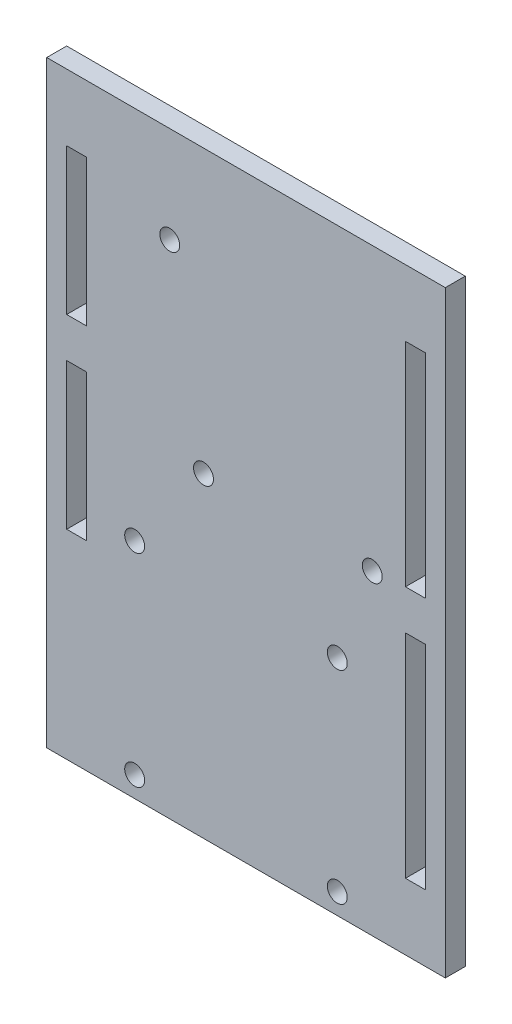
from build123d import *

# Parameters (mm, degrees)
SKETCH1_W           = 60
SKETCH1_H           = 90
BOSS_EXTRUDE1_DEPTH = 3
SKETCH3_R           = 1.5
CUT_EXTRUDE2_DEPTH  = 3
SKETCH4_R           = 1.5
CUT_EXTRUDE3_DEPTH  = 55.166410256
SKETCH5_W           = 3
SKETCH5_H           = 32
CUT_EXTRUDE4_DEPTH  = 55.166410256
SKETCH6_W           = 3
SKETCH6_H           = 22
CUT_EXTRUDE5_DEPTH  = 55.166410256


with BuildPart() as part:
    # Sketch1 → Boss-Extrude1 (new body)
    with BuildSketch(Plane.XY):
        Rectangle(SKETCH1_W, SKETCH1_H)
    extrude(amount=-BOSS_EXTRUDE1_DEPTH)

    # Sketch3 → Cut-Extrude2 (cut)
    with BuildSketch(Plane.XY):
        with Locations((-11.48, 30.5)):
            Circle(SKETCH3_R)
        with Locations((-6.4, 2.56)):
            Circle(SKETCH3_R)
        with Locations((19, 2.56)):
            Circle(SKETCH3_R)
    extrude(amount=-CUT_EXTRUDE2_DEPTH, mode=Mode.SUBTRACT)

    # Sketch4 → Cut-Extrude3 (cut, through all)
    with BuildSketch(Plane.XY):
        with Locations((-16.762789551, -41.88018292)):
            Circle(SKETCH4_R)
        with Locations((-16.762789551, -11.38018292)):
            Circle(SKETCH4_R)
        with Locations((13.737210449, -41.88018292)):
            Circle(SKETCH4_R)
        with Locations((13.737210449, -11.38018292)):
            Circle(SKETCH4_R)
    extrude(amount=-CUT_EXTRUDE3_DEPTH, mode=Mode.SUBTRACT)

    # Sketch5 → Cut-Extrude4 (cut, through all)
    with BuildSketch(Plane.XY):
        with Locations((25.5, -19)):
            Rectangle(SKETCH5_W, SKETCH5_H)
        with Locations((25.5, 19)):
            Rectangle(SKETCH5_W, SKETCH5_H)
    extrude(amount=-CUT_EXTRUDE4_DEPTH, mode=Mode.SUBTRACT)

    # Sketch6 → Cut-Extrude5 (cut, through all)
    with BuildSketch(Plane.XY):
        with Locations((-25.5, -4)):
            Rectangle(SKETCH6_W, SKETCH6_H)
        with Locations((-25.5, 24)):
            Rectangle(SKETCH6_W, SKETCH6_H)
    extrude(amount=-CUT_EXTRUDE5_DEPTH, mode=Mode.SUBTRACT)


solid = part.part
